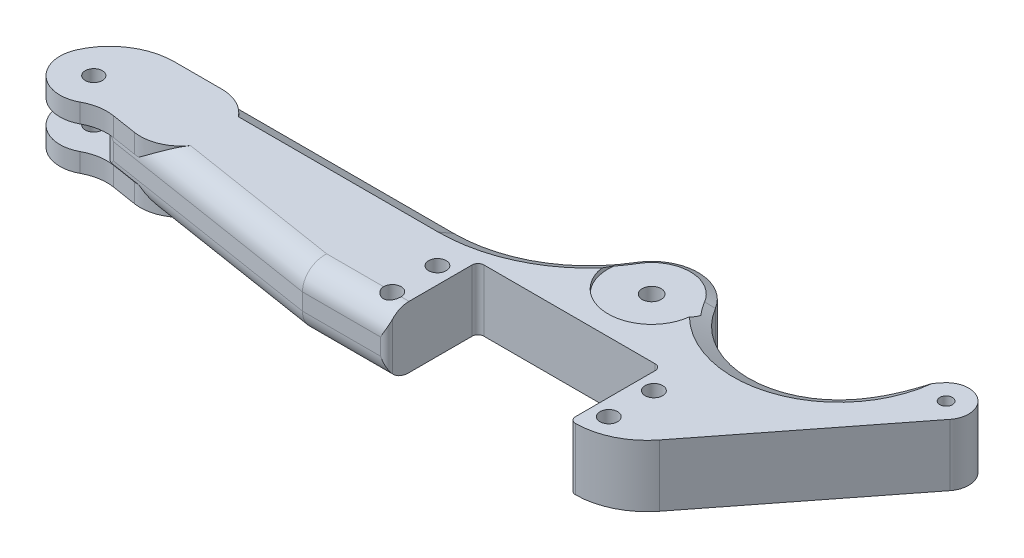
from build123d import *

# Parameters (mm, degrees)
SKETCH1_R           = 1.95
SKETCH1_R_2         = 1.4
SKETCH1_R_3         = 2.1
BOSS_EXTRUDE1_DEPTH = 6.85
FILLET1_R           = 1.3
FILLET2_R           = 5
SKETCH2_R           = 9.65
CUT_EXTRUDE1_DEPTH  = 1
SKETCH3_R           = 1.9
BOSS_EXTRUDE2_DEPTH = 4.2


with BuildPart() as part:
    # Sketch1 → Boss-Extrude1 (new, symmetric)
    with BuildSketch(Plane(origin=(0, 0, 0), x_dir=(1, 0, 0), z_dir=(0, 1, 0))):
        with BuildLine():
            Line((-20.3, 0), (-20.3, 20.3))
            Line((-20.3, 20.3), (20.3, 20.3))
            Line((20.3, 20.3), (20.3, 0))
            Line((20.3, 0), (21.471002215, 0))
            ThreePointArc((21.471002215, 0), (28.484940564, 1.619295259), (34.079174273, 6.149416395))
            Line((34.079174273, 6.149416395), (62.340053768, 42.321692623))
            ThreePointArc((62.340053768, 42.321692623), (61.478307377, 49.340053768), (54.459946232, 48.478307377))
            Line((54.459946232, 48.478307377), (45.923690949, 37.552398858))
            ThreePointArc((45.923690949, 37.552398858), (28.943857205, 29.911819074), (13.0374126, 39.59057072))
            ThreePointArc((13.0374126, 39.59057072), (4.2, 44.6), (-4.6374126, 39.59057072))
            ThreePointArc((-4.6374126, 39.59057072), (-15.583580271, 28.901313458), (-30.377449299, 25))
            Line((-30.377449299, 25), (-92.318081503, 25))
            ThreePointArc((-92.318081503, 25), (-95.170063764, 22.930697149), (-94.087636009, 19.577464789))
            ThreePointArc((-94.087636009, 19.577464789), (-91.411351451, 16.016454096), (-91.172530814, 11.56827909))
            ThreePointArc((-91.172530814, 11.56827909), (-90.759336764, 9.19094994), (-88.729101195, 7.886892142))
            Line((-88.729101195, 7.886892142), (-38.933223987, 0))
            Line((-38.933223987, 0), (-20.3, 0))
        make_face()
        with Locations(Location((-24, 15, 0), (0, 0, 90))):
            Circle(SKETCH1_R, mode=Mode.SUBTRACT)
        with Locations(Location((-24, 5, 0), (0, 0, 90))):
            Circle(SKETCH1_R, mode=Mode.SUBTRACT)
        with Locations(Location((58.4, 45.4, 0), (0, 0, 90))):
            Circle(SKETCH1_R_2, mode=Mode.SUBTRACT)
        with Locations(Location((4.2, 34.3, 0), (0, 0, 90))):
            Circle(SKETCH1_R_3, mode=Mode.SUBTRACT)
        with Locations(Location((24, 15, 0), (0, 0, 90))):
            Circle(SKETCH1_R, mode=Mode.SUBTRACT)
        with Locations(Location((24, 5, 0), (0, 0, 90))):
            Circle(SKETCH1_R, mode=Mode.SUBTRACT)
    extrude(amount=BOSS_EXTRUDE1_DEPTH, both=True)

    # Chamfer1
    # the kernel refuses this chamfer: 3.464101615, 2 mm, written as the material it takes off along each edge
    with BuildSketch(Plane(origin=(-30.377449299, -6.85, -25), x_dir=(0, 0.9983227437537926, -0.05789386240267147), z_dir=(-1, 0, 0))) as chamfer1_piece_1:
        with BuildLine():
            Line((2.07275858, 0), (-0.276663314, -3.574079154))
            Line((-0.276663314, -3.574079154), (-0.345829143, -3.570068149))
            ThreePointArc((-0.345829143, -3.570068149), (-0.172914571, -1.785034075), (-0.069165829, 0.004011004))
            Line((-0.069165829, 0.004011004), (0.004011004, 0.069165829))
            ThreePointArc((0.004011004, 0.069165829), (1.036916662, 0.009266464), (2.076769584, 0.069165829))
            Line((2.076769584, 0.069165829), (2.07275858, 0))
        make_face()
    extrude(amount=83.449259263, mode=Mode.SUBTRACT)
    with BuildSketch(Plane(origin=(-30.377449299, 6.85, -25), x_dir=(0, -0.9983227437537926, -0.05789386240267147), z_dir=(-1, 0, 0))) as chamfer1_piece_2:
        with BuildLine():
            Line((2.07275858, 0), (-0.276663314, 3.574079154))
            Line((-0.276663314, 3.574079154), (-0.345829143, 3.570068149))
            ThreePointArc((-0.345829143, 3.570068149), (-0.172914571, 1.785034075), (-0.069165829, -0.004011004))
            Line((-0.069165829, -0.004011004), (0.004011004, -0.069165829))
            ThreePointArc((0.004011004, -0.069165829), (1.036916662, -0.009266464), (2.076769584, -0.069165829))
            Line((2.076769584, -0.069165829), (2.07275858, 0))
        make_face()
    extrude(amount=83.449259263, mode=Mode.SUBTRACT)
    with BuildSketch(Plane(origin=(-30.377449299, -6.85, -55), x_dir=(0.8580012232913082, 0, 0.5136476426799005), z_dir=(0.5136476426799005, 0, -0.8580012232913082))) as chamfer1_piece_3:
        with BuildLine():
            Line((29.88, -2.069282032), (33.584101615, 0.069282032))
            Line((33.584101615, 0.069282032), (33.584101615, 0.138564065))
            ThreePointArc((33.584101615, 0.138564065), (31.792050808, 0.069282032), (30, 0.069282032))
            Line((30, 0.069282032), (29.930717968, 0))
            ThreePointArc((29.930717968, 0), (29.930717968, -1.034641016), (29.810717968, -2.069282032))
            Line((29.810717968, -2.069282032), (29.88, -2.069282032))
        make_face()
    revolve(axis=Axis((-30.377449299, -6.85, -55), (0, -1, 0)), revolution_arc=59.092895689, mode=Mode.SUBTRACT)
    with BuildSketch(Plane(origin=(-30.377449299, 6.85, -55), x_dir=(0.8580012232913082, 0, 0.5136476426799005), z_dir=(0.5136476426799005, 0, -0.8580012232913082))) as chamfer1_piece_4:
        with BuildLine():
            Line((29.88, 2.069282032), (33.584101615, -0.069282032))
            Line((33.584101615, -0.069282032), (33.584101615, -0.138564065))
            ThreePointArc((33.584101615, -0.138564065), (31.792050808, -0.069282032), (30, -0.069282032))
            Line((30, -0.069282032), (29.930717968, 0))
            ThreePointArc((29.930717968, 0), (29.930717968, 1.034641016), (29.810717968, 2.069282032))
            Line((29.810717968, 2.069282032), (29.88, 2.069282032))
        make_face()
    revolve(axis=Axis((-30.377449299, 6.85, -55), (0, -1, 0)), revolution_arc=59.092895689, mode=Mode.SUBTRACT)
    with BuildSketch(Plane(origin=(4.2, -6.85, -34.3), x_dir=(0.8580012232913079, 0, -0.5136476426799007), z_dir=(0.5136476426799007, 0, 0.8580012232913079))) as chamfer1_piece_5:
        with BuildLine():
            Line((10.42, 2.069282032), (6.715898385, -0.069282032))
            Line((6.715898385, -0.069282032), (6.715898385, -0.138564065))
            ThreePointArc((6.715898385, -0.138564065), (8.507949192, -0.069282032), (10.3, -0.069282032))
            Line((10.3, -0.069282032), (10.369282032, 0))
            ThreePointArc((10.369282032, 0), (10.369282032, 1.034641016), (10.489282032, 2.069282032))
            Line((10.489282032, 2.069282032), (10.42, 2.069282032))
        make_face()
    revolve(axis=Axis((4.2, -6.85, -34.3), (0, 1, 0)), revolution_arc=118.185791378, mode=Mode.SUBTRACT)
    with BuildSketch(Plane(origin=(4.2, 6.85, -34.3), x_dir=(0.8580012232913079, 0, -0.5136476426799007), z_dir=(0.5136476426799007, 0, 0.8580012232913079))) as chamfer1_piece_6:
        with BuildLine():
            Line((10.42, -2.069282032), (6.715898385, 0.069282032))
            Line((6.715898385, 0.069282032), (6.715898385, 0.138564065))
            ThreePointArc((6.715898385, 0.138564065), (8.507949192, 0.069282032), (10.3, 0.069282032))
            Line((10.3, 0.069282032), (10.369282032, 0))
            ThreePointArc((10.369282032, 0), (10.369282032, -1.034641016), (10.489282032, -2.069282032))
            Line((10.489282032, -2.069282032), (10.42, -2.069282032))
        make_face()
    revolve(axis=Axis((4.2, 6.85, -34.3), (0, 1, 0)), revolution_arc=118.185791378, mode=Mode.SUBTRACT)
    with BuildSketch(Plane(origin=(30.179734436, -6.85, -49.852925786), x_dir=(0.9155287749466202, 0, -0.40225248569118977), z_dir=(-0.40225248569118977, 0, -0.9155287749466202))) as chamfer1_piece_7:
        with BuildLine():
            Line((19.859367593, -2.069282032), (23.563469209, 0.069282032))
            Line((23.563469209, 0.069282032), (23.563469209, 0.138564065))
            ThreePointArc((23.563469209, 0.138564065), (21.771418401, 0.069282032), (19.979367593, 0.069282032))
            Line((19.979367593, 0.069282032), (19.910085561, 0))
            ThreePointArc((19.910085561, 0), (19.910085561, -1.034641016), (19.790085561, -2.069282032))
            Line((19.790085561, -2.069282032), (19.859367593, -2.069282032))
        make_face()
    revolve(axis=Axis((30.179734436, -6.85, -49.852925786), (0, -1, 0)), revolution_arc=172.811963649, mode=Mode.SUBTRACT)
    with BuildSketch(Plane(origin=(30.179734436, 6.85, -49.852925786), x_dir=(0.9155287749466202, 0, -0.40225248569118977), z_dir=(-0.40225248569118977, 0, -0.9155287749466202))) as chamfer1_piece_8:
        with BuildLine():
            Line((19.859367593, 2.069282032), (23.563469209, -0.069282032))
            Line((23.563469209, -0.069282032), (23.563469209, -0.138564065))
            ThreePointArc((23.563469209, -0.138564065), (21.771418401, -0.069282032), (19.979367593, -0.069282032))
            Line((19.979367593, -0.069282032), (19.910085561, 0))
            ThreePointArc((19.910085561, 0), (19.910085561, 1.034641016), (19.790085561, 2.069282032))
            Line((19.790085561, 2.069282032), (19.859367593, 2.069282032))
        make_face()
    revolve(axis=Axis((30.179734436, 6.85, -49.852925786), (0, -1, 0)), revolution_arc=172.811963649, mode=Mode.SUBTRACT)

    # Fillet1
    fillet1_edges = [part.edges().sort_by_distance(p)[0] for p in [
        (20.3, 0, -20.3),
        (20.3, 0, 0),
        (-20.3, 0, 0),
        (-20.3, 0, -20.3),
    ]]
    fillet(fillet1_edges, radius=FILLET1_R)

    # Fillet2
    # the kernel refuses this fillet: 5 mm, written as the material it takes off along each edge
    with BuildSketch(Plane(origin=(-51.433223987, -6.85, 0), x_dir=(0, 0, -1), z_dir=(1, 0, 0)), Plane(origin=(-51.433223987, 6.85, 0), x_dir=(0, -1, 0), z_dir=(1, 0, 0))) as fillet2_piece_1:
        with BuildLine():
            CenterArc((FILLET2_R, FILLET2_R), FILLET2_R, 180, 90)
            Line((0, FILLET2_R), (0, 0))
            Line((0, 0), (FILLET2_R, 0))
        make_face()
    extrude(amount=42.333223987, mode=Mode.SUBTRACT)
    with BuildSketch(Plane(origin=(-101.075205453, -6.85, -9.842322955), x_dir=(0.1564344650402311, 0, -0.9876883405951377), z_dir=(0.9876883405951378, 0, 0.15643446504023112)), Plane(origin=(-101.075205453, 6.85, -9.842322955), x_dir=(0, -1, 0), z_dir=(0.9876883405951378, 0, 0.15643446504023112))) as fillet2_piece_2:
        with BuildLine():
            CenterArc((FILLET2_R, FILLET2_R), FILLET2_R, 180, 90)
            Line((0, FILLET2_R), (0, 0))
            Line((0, 0), (FILLET2_R, 0))
        make_face()
    extrude(amount=75.416589082, mode=Mode.SUBTRACT)

    # Sketch2 → Cut-Extrude1 (cut)
    with BuildSketch(Plane(origin=(0, 6.85, 0), x_dir=(1, 0, 0), z_dir=(0, 1, 0))):
        with Locations((4.2, 34.3)):
            Circle(SKETCH2_R)
    cut_extrude1 = extrude(amount=-CUT_EXTRUDE1_DEPTH, mode=Mode.SUBTRACT)

    # Mirror1: Cut-Extrude1 across plane
    add(cut_extrude1.mirror(Plane.ZX), mode=Mode.SUBTRACT)

    # Sketch3 → Boss-Extrude2 (add)
    with BuildSketch(Plane(origin=(0, 6.85, 0), x_dir=(1, 0, 0), z_dir=(0, 1, 0))):
        with BuildLine():
            Line((-92.318081503, 25), (-81.792416362, 25))
            ThreePointArc((-81.792416362, 25), (-72.770828977, 15.240501751), (-83.208067539, 7.012446316))
            Line((-83.208067539, 7.012446316), (-88.729101195, 7.886892142))
            ThreePointArc((-88.729101195, 7.886892142), (-91.966126704, 7.866158061), (-95.024995199, 6.806871708))
            ThreePointArc((-95.024995199, 6.806871708), (-103.679928258, 7.882362019), (-105.465484696, 16.419125683))
            ThreePointArc((-105.465484696, 16.419125683), (-100.168011674, 22.664968668), (-92.318081503, 25))
        make_face()
        with Locations(Location((-98.6, 13.4, 0), (0, 0, 270))):
            Circle(SKETCH3_R, mode=Mode.SUBTRACT)
    boss_extrude2 = extrude(amount=-BOSS_EXTRUDE2_DEPTH)

    # Mirror2: Boss-Extrude2 across plane
    add(boss_extrude2.mirror(Plane.ZX))


solid = part.part
